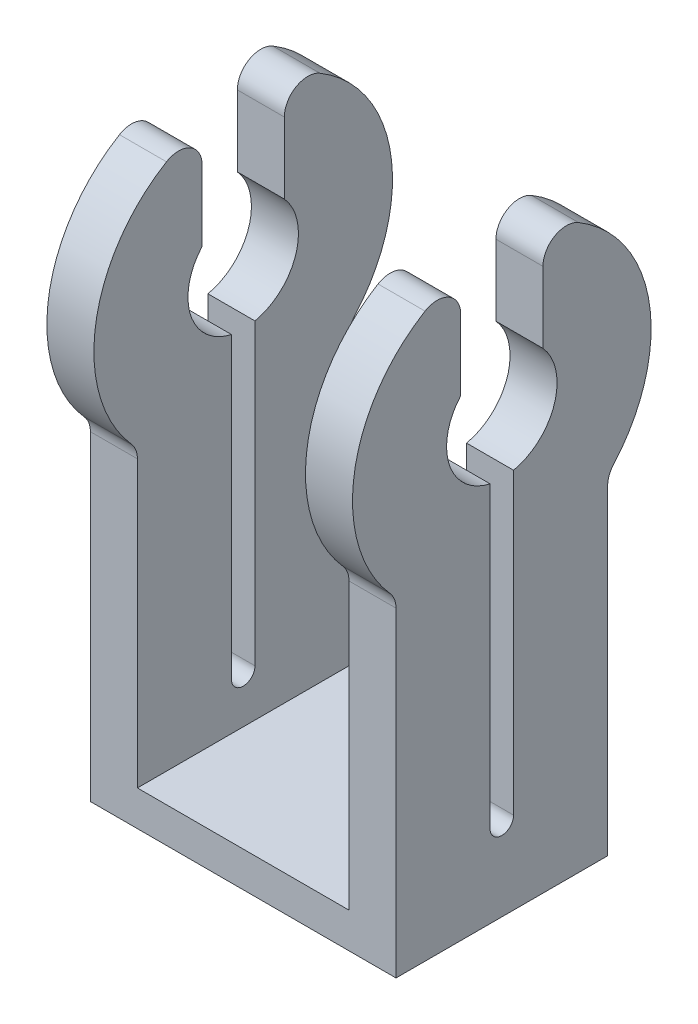
from build123d import *

# Parameters (mm, degrees)
SKETCH1_W            = 13
SKETCH1_H            = 9
BOSS_EXTRUDE1_DEPTH  = 1.5
BOSS_EXTRUDE2_DEPTH  = 2
FILLET1_R            = 1
FILLET1_OF_MIRROR1_R = 1


with BuildPart() as part:
    # Sketch1 → Boss-Extrude1 (new body)
    with BuildSketch(Plane(origin=(0, 0, 0), x_dir=(1, 0, 0), z_dir=(0, 1, 0))):
        Rectangle(SKETCH1_W, SKETCH1_H)
    extrude(amount=BOSS_EXTRUDE1_DEPTH)

    # Sketch2 → Boss-Extrude2 (add)
    with BuildSketch(Plane.ZY.offset(6.5)):
        with BuildLine():
            Line((-4.5, 1.5), (4.5, 1.5))
            Line((4.5, 1.5), (4.5, 14.019765631))
            ThreePointArc((4.5, 14.019765631), (6.145945212, 20.096827307), (1.75, 24.604096985))
            Line((1.75, 24.604096985), (1.75, 20.068438714))
            ThreePointArc((1.75, 20.068438714), (2.235949151, 17.776790906), (0.5, 16.203807499))
            Line((0.5, 16.203807499), (0.5, 3.5))
            ThreePointArc((0.5, 3.5), (0, 3), (-0.5, 3.5))
            Line((-0.5, 3.5), (-0.5, 16.203807499))
            ThreePointArc((-0.5, 16.203807499), (-2.235949151, 17.776790906), (-1.75, 20.068438714))
            Line((-1.75, 20.068438714), (-1.75, 24.604096985))
            ThreePointArc((-1.75, 24.604096985), (-6.145945212, 20.096827307), (-4.5, 14.019765631))
            Line((-4.5, 14.019765631), (-4.5, 1.5))
        make_face()
    boss_extrude2 = extrude(amount=-BOSS_EXTRUDE2_DEPTH)

    # Fillet1
    fillet1_edges = [part.edges().sort_by_distance(p)[0] for p in [
        (-5.5, 14.019765631, 4.5),
        (-5.5, 14.019765631, -4.5),
        (-5.5, 24.604096985, 1.75),
        (-5.5, 24.604096985, -1.75),
    ]]
    fillet(fillet1_edges, radius=FILLET1_R)

    # Mirror1: Boss-Extrude2 across plane
    add(boss_extrude2.mirror(Plane(origin=(0, 0, 0), x_dir=(0, 0, 1), z_dir=(1, 0, 0))))

    # Fillet1 of Mirror1
    fillet1_of_mirror1_edges = [part.edges().sort_by_distance(p)[0] for p in [
        (5.5, 14.019765631, 4.5),
        (5.5, 14.019765631, -4.5),
        (5.5, 24.604096985, 1.75),
        (5.5, 24.604096985, -1.75),
    ]]
    fillet(fillet1_of_mirror1_edges, radius=FILLET1_OF_MIRROR1_R)


solid = part.part
